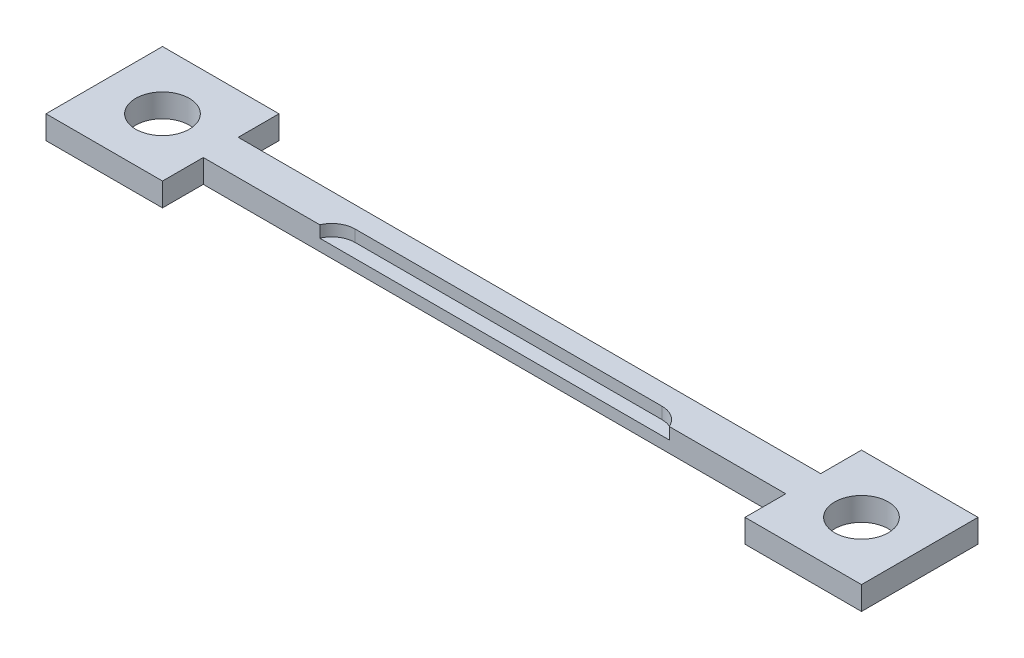
from build123d import *

# Parameters (mm, degrees)
BOSS_EXTRUDE1_DEPTH          = 0.635
F_97_0_0059_DIAMETER_HOLE1_D = 2.921
SKETCH5_W                    = 19.05
SKETCH5_H                    = 0.762
CUT_EXTRUDE1_DEPTH           = 0.635
FILLET4_R                    = 1.27
FILLET5_R                    = 1.27


with BuildPart() as part:
    # Sketch1 → Boss-Extrude1 (new, symmetric)
    with BuildSketch(Plane(origin=(0, 0, 0), x_dir=(1, 0, 0), z_dir=(0, 1, 0))):
        Polygon((-41.424046485, -10.283259465), (-41.424046485, -12.505759465), (-47.774046485, -12.505759465), (-47.774046485, -6.155759465), (-41.424046485, -6.155759465), (-41.424046485, -8.378259465), (-9.674046485, -8.378259465), (-9.674046485, -6.155759465), (-3.324046485, -6.155759465), (-3.324046485, -12.505759465), (-9.674046485, -12.505759465), (-9.674046485, -10.283259465), align=None)
    extrude(amount=BOSS_EXTRUDE1_DEPTH, both=True)

    # #97 (0.0059) Diameter Hole1 (through all)
    with Locations(Plane(origin=(0, 0.635, 0), x_dir=(-1, 0, 0), z_dir=(0, 1, 0))):
        with Locations((44.599046485, 9.330759465)):
            f_97_0_0059_diameter_hole1 = Hole(F_97_0_0059_DIAMETER_HOLE1_D / 2)

    # Mirror1: #97 (0.0059) Diameter Hole1 across plane
    add(f_97_0_0059_diameter_hole1.mirror(Plane(origin=(-25.549046485, 0, 0), x_dir=(0, 0, 1), z_dir=(1, 0, 0))), mode=Mode.SUBTRACT)

    # Sketch5 → Cut-Extrude1 (cut)
    with BuildSketch(Plane(origin=(0, 0.635, 0), x_dir=(1, 0, 0), z_dir=(0, 1, 0))):
        with Locations((-25.549046485, -9.902259465)):
            Rectangle(SKETCH5_W, SKETCH5_H)
    extrude(amount=-CUT_EXTRUDE1_DEPTH, mode=Mode.SUBTRACT)

    # Fillet4
    # the kernel refuses this fillet: 1.27 mm, written as the material it adds along each edge
    with BuildSketch(Plane(origin=(-35.074046485, 0.635, 9.521259465), x_dir=(0, 0, 1), z_dir=(0, -1, 0))) as fillet4_piece_1:
        with BuildLine():
            CenterArc((1.27, -1.163974227), FILLET4_R, 113.578178478, 66.421821522)
            Line((0, -1.163974227), (-0.0254, -1.163974227))
            Line((-0.0254, -1.163974227), (-0.0254, 0))
            Line((-0.0254, 0), (0, 0.0254))
            ThreePointArc((0, 0.0254), (0.381, 0.0254), (0.75184, 0.023279485))
            Line((0.75184, 0.023279485), (0.762, 0))
        make_face()
    extrude(amount=0.635)

    # Fillet5
    # the kernel refuses this fillet: 1.27 mm, written as the material it adds along each edge
    with BuildSketch(Plane(origin=(-16.024046485, 0.635, 9.521259465), x_dir=(-1, 0, 0), z_dir=(0, -1, 0))) as fillet5_piece_1:
        with BuildLine():
            CenterArc((1.163974227, -1.27), FILLET5_R, 90, 66.421821522)
            Line((0, -0.762), (-0.023279485, -0.75184))
            ThreePointArc((-0.023279485, -0.75184), (-0.0254, -0.381), (-0.0254, 0))
            Line((-0.0254, 0), (0, 0.0254))
            Line((0, 0.0254), (1.163974227, 0.0254))
            Line((1.163974227, 0.0254), (1.163974227, 0))
        make_face()
    extrude(amount=0.635)


solid = part.part
